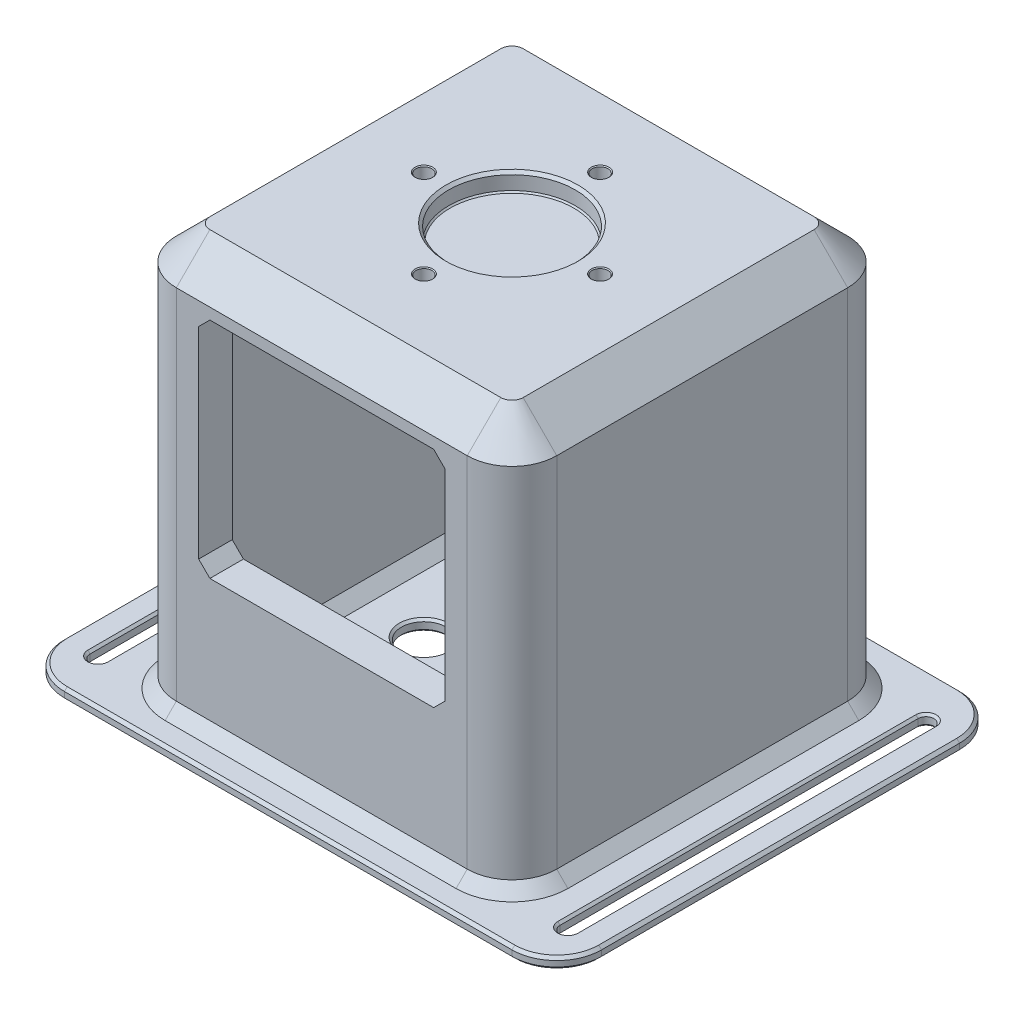
from build123d import *

# Parameters (mm, degrees)
SKETCH1_W                   = 152.4
SKETCH1_H                   = 127
BOSS_EXTRUDE1_DEPTH         = 3.175
SKETCH2_W                   = 69.85
SKETCH2_H                   = 9.525
BOSS_EXTRUDE2_DEPTH         = 38.1
BOSS_EXTRUDE3_DEPTH         = 101.6
BOSS_EXTRUDE4_START         = 101.6
SKETCH2_4_W                 = 69.85
SKETCH2_4_H                 = 9.525
SKETCH2_4_W_2               = 88.9
SKETCH2_4_H_2               = 88.9
BOSS_EXTRUDE4_DEPTH         = 12.7
CUT_EXTRUDE1_DEPTH          = 154.750010163
CUT_EXTRUDE1_DEPTH_BACK     = 5.08
SKETCH7_R                   = 17.9578
F_8_START                   = -50.8
F_8_CLEARANCE_SLOT1_2_DEPTH = 101.6
CIRPATTERN1_COUNT           = 4
FILLET2_R                   = 3.175
FILLET1_R                   = 12.7
CHAMFER1_SIZE               = 3.175
CHAMFER2_SIZE               = 9.525
CHAMFER4_SIZE               = 3.175
CHAMFER3_SIZE               = 0.79375
CHAMFER5_SIZE               = 0.79375
CHAMFER6_SIZE               = 0.396875


with BuildPart() as part:
    # Sketch1 → Boss-Extrude1 (new body)
    with BuildSketch(Plane(origin=(0, 0, 0), x_dir=(1, 0, 0), z_dir=(0, 1, 0))):
        Rectangle(SKETCH1_W, SKETCH1_H)
    extrude(amount=BOSS_EXTRUDE1_DEPTH)

    # Sketch2 → Boss-Extrude2 (add)
    with BuildSketch(Plane(origin=(0, 3.175, 0), x_dir=(1, 0, 0), z_dir=(0, 1, 0))):
        Polygon((-34.925, 53.975), (-53.975, 53.975), (-53.975, -53.975), (-34.925, -53.975), (-34.925, -44.45), (-44.45, -44.45), (-44.45, 44.45), (-34.925, 44.45), align=None)
        with Locations((0, 49.2125)):
            Rectangle(SKETCH2_W, SKETCH2_H)
        Polygon((53.975, 53.975), (34.925, 53.975), (34.925, 44.45), (44.45, 44.45), (44.45, -44.45), (34.925, -44.45), (34.925, -53.975), (53.975, -53.975), align=None)
        with Locations((0, -49.2125)):
            Rectangle(SKETCH2_W, SKETCH2_H)
    extrude(amount=BOSS_EXTRUDE2_DEPTH)

    # Sketch2<3> → Boss-Extrude3 (add)
    with BuildSketch(Plane(origin=(0, 3.175, 0), x_dir=(1, 0, 0), z_dir=(0, 1, 0))):
        Polygon((-34.925, 53.975), (-53.975, 53.975), (-53.975, -53.975), (-34.925, -53.975), (-34.925, -44.45), (-44.45, -44.45), (-44.45, 44.45), (-34.925, 44.45), align=None)
        Polygon((53.975, 53.975), (34.925, 53.975), (34.925, 44.45), (44.45, 44.45), (44.45, -44.45), (34.925, -44.45), (34.925, -53.975), (53.975, -53.975), align=None)
    extrude(amount=BOSS_EXTRUDE3_DEPTH)

    # Sketch2<4> → Boss-Extrude4 (add)
    with BuildSketch(Plane(origin=(0, 3.175, 0), x_dir=(1, 0, 0), z_dir=(0, 1, 0)).offset(BOSS_EXTRUDE4_START)):
        with Locations((0, 49.2125)):
            Rectangle(SKETCH2_4_W, SKETCH2_4_H)
        Polygon((-34.925, 53.975), (-53.975, 53.975), (-53.975, -53.975), (-34.925, -53.975), (-34.925, -44.45), (-44.45, -44.45), (-44.45, 44.45), (-34.925, 44.45), align=None)
        with Locations((0, -49.2125)):
            Rectangle(SKETCH2_4_W, SKETCH2_4_H)
        Polygon((53.975, 53.975), (34.925, 53.975), (34.925, 44.45), (44.45, 44.45), (44.45, -44.45), (34.925, -44.45), (34.925, -53.975), (53.975, -53.975), align=None)
        Rectangle(SKETCH2_4_W_2, SKETCH2_4_H_2)
    extrude(amount=BOSS_EXTRUDE4_DEPTH)

    # Sketch7 → Cut-Extrude1 (cut, two sides: drawn at the far end of the back side and taken through both)
    with BuildSketch(Plane(origin=(0, 117.475, 0), x_dir=(1, 0, 0), z_dir=(0, 1, 0)).offset(-CUT_EXTRUDE1_DEPTH_BACK)):
        with Locations(Location((0, 0, 0), (0, 0, 90))):
            Circle(SKETCH7_R)
    extrude(amount=CUT_EXTRUDE1_DEPTH + CUT_EXTRUDE1_DEPTH_BACK, mode=Mode.SUBTRACT)

    # #8 Clearance Slot1: read off the stored shape, not the designer's step
    # #8 Clearance Slot1 outline → #8 Clearance Slot1 (revolve, cut)
    with BuildSketch(Plane(origin=(66.675, 0, -50.8), x_dir=(1, 0, 0), z_dir=(0, 0, 1))):
        Polygon((0, 0), (2.8829, 0), (2.2479, 0.635), (2.2479, 2.54), (2.8829, 3.175), (0, 3.175), align=None)
    revolve(axis=Axis((66.675, 0, -50.8), (0, 1, 0)), mode=Mode.SUBTRACT)

    # 8 Clearance Slot1 2 outline → 8 Clearance Slot1 2 (cut)
    with BuildSketch(Plane.XY.offset(F_8_START)):
        Polygon((69.5579, 3.175), (63.7921, 3.175), (64.4271, 2.54), (64.4271, 0.635), (63.7921, 0), (69.5579, 0), (68.9229, 0.635), (68.9229, 2.54), align=None)
        Polygon((-64.4271, 2.54), (-63.7921, 3.175), (-69.5579, 3.175), (-68.9229, 2.54), (-68.9229, 0.635), (-69.5579, 0), (-63.7921, 0), (-64.4271, 0.635), align=None)
    extrude(amount=F_8_CLEARANCE_SLOT1_2_DEPTH, mode=Mode.SUBTRACT)

    # 8 Clearance Slot1 3 outline → 8 Clearance Slot1 3 (revolve, cut)
    with BuildSketch(Plane(origin=(66.675, 0, 50.8), x_dir=(1, 0, 0), z_dir=(0, 0, 1))):
        Polygon((0, 0), (2.8829, 0), (2.2479, 0.635), (2.2479, 2.54), (2.8829, 3.175), (0, 3.175), align=None)
    revolve(axis=Axis((66.675, 0, 50.8), (0, 1, 0)), mode=Mode.SUBTRACT)

    # 8 Clearance Slot1 4 outline → 8 Clearance Slot1 4 (revolve, cut)
    with BuildSketch(Plane(origin=(-66.675, 0, -50.8), x_dir=(1, 0, 0), z_dir=(0, 0, 1))):
        Polygon((0, 0), (2.8829, 0), (2.2479, 0.635), (2.2479, 2.54), (2.8829, 3.175), (0, 3.175), align=None)
    revolve(axis=Axis((-66.675, 0, -50.8), (0, 1, 0)), mode=Mode.SUBTRACT)

    # 8 Clearance Slot1 5 outline → 8 Clearance Slot1 5 (revolve, cut)
    with BuildSketch(Plane(origin=(-66.675, 0, 50.8), x_dir=(1, 0, 0), z_dir=(0, 0, 1))):
        Polygon((0, 0), (2.8829, 0), (2.2479, 0.635), (2.2479, 2.54), (2.8829, 3.175), (0, 3.175), align=None)
    revolve(axis=Axis((-66.675, 0, 50.8), (0, 1, 0)), mode=Mode.SUBTRACT)

    # Sketch11 → 1/2 (0.5) Diameter Hole1 (revolve, cut)
    with BuildSketch(Plane(origin=(25, 0, 0), x_dir=(0, 0, -1), z_dir=(1, 0, 0))):
        Polygon((0, 0), (0, 3.175), (6.985, 3.175), (6.35, 2.54), (6.35, 0.635), (6.985, 0), align=None)
    f_1_2_0_5_diameter_hole1 = revolve(axis=Axis((25, -6.35, 0), (0, 1, 0)), mode=Mode.SUBTRACT)

    # Sketch13 → #8 Clearance Hole2 (revolve, cut)
    with BuildSketch(Plane(origin=(25, 104.775, 0), x_dir=(0, 0, -1), z_dir=(1, 0, 0))):
        Polygon((0, 0), (0, 12.7), (2.5019, 12.7), (2.2479, 12.446), (2.2479, 0.635), (2.8829, 0), align=None)
    f_8_clearance_hole2 = revolve(axis=Axis((25, 98.425, 0), (0, 1, 0)), mode=Mode.SUBTRACT)

    # CirPattern1: 1/2 (0.5) Diameter Hole1, #8 Clearance Hole2 ×4 about axis
    cirpattern1_axis = Axis((0, 0, 0), (0, 1, 0))
    add([f_1_2_0_5_diameter_hole1.rotate(cirpattern1_axis, i * 360 / CIRPATTERN1_COUNT) for i in range(1, CIRPATTERN1_COUNT)], mode=Mode.SUBTRACT)
    add([f_8_clearance_hole2.rotate(cirpattern1_axis, i * 360 / CIRPATTERN1_COUNT) for i in range(1, CIRPATTERN1_COUNT)], mode=Mode.SUBTRACT)

    # Fillet2
    fillet2_edges = [part.edges().sort_by_distance(p)[0] for p in [
        (-44.45, 53.975, -44.45),
        (44.45, 53.975, -44.45),
        (44.45, 53.975, 44.45),
        (-44.45, 53.975, 44.45),
    ]]
    fillet(fillet2_edges, radius=FILLET2_R)

    # Fillet1
    fillet1_edges = [part.edges().sort_by_distance(p)[0] for p in [
        (53.975, 60.325, 53.975),
        (53.975, 60.325, -53.975),
        (-53.975, 60.325, -53.975),
        (-53.975, 60.325, 53.975),
        (76.2, 1.5875, 63.5),
        (-76.2, 1.5875, 63.5),
        (-76.2, 1.5875, -63.5),
        (76.2, 1.5875, -63.5),
    ]]
    fillet(fillet1_edges, radius=FILLET1_R)

    # Chamfer1
    chamfer1_edges = [part.edges().sort_by_distance(p)[0] for p in [
        (0, 3.175, -44.45),
        (-44.45, 3.175, 0),
        (0, 3.175, 44.45),
        (44.45, 3.175, 0),
        (43.52006403, 3.175, 43.52006403),
        (-43.52006403, 3.175, 43.52006403),
        (43.52006403, 3.175, -43.52006403),
        (-43.52006403, 3.175, -43.52006403),
        (53.975, 3.175, 0),
        (0, 3.175, 53.975),
        (-53.975, 3.175, 0),
        (0, 3.175, -53.975),
        (-50.255256121, 3.175, -50.255256121),
        (50.255256121, 3.175, -50.255256121),
        (50.255256121, 3.175, 50.255256121),
        (-50.255256121, 3.175, 50.255256121),
    ]]
    chamfer(chamfer1_edges, length=CHAMFER1_SIZE)

    # Chamfer2
    chamfer2_edges = [part.edges().sort_by_distance(p)[0] for p in [
        (-53.975, 117.475, 0),
        (0, 117.475, -53.975),
        (0, 117.475, 53.975),
        (53.975, 117.475, 0),
        (-50.255256121, 117.475, 50.255256121),
        (50.255256121, 117.475, 50.255256121),
        (50.255256121, 117.475, -50.255256121),
        (-50.255256121, 117.475, -50.255256121),
    ]]
    chamfer(chamfer2_edges, length=CHAMFER2_SIZE)

    # Chamfer4
    chamfer4_edges = [part.edges().sort_by_distance(p)[0] for p in [
        (-38.1, 104.775, -44.45),
        (-44.45, 104.775, 0),
        (44.45, 104.775, 0),
        (-38.1, 104.775, 44.45),
        (43.52006403, 104.775, 43.52006403),
        (-43.52006403, 104.775, 43.52006403),
        (43.52006403, 104.775, -43.52006403),
        (-43.52006403, 104.775, -43.52006403),
        (-34.925, 41.275, 49.2125),
        (-34.925, 41.275, -49.2125),
        (-34.925, 104.775, -49.2125),
        (-34.925, 104.775, 49.2125),
        (34.925, 41.275, -49.2125),
        (34.925, 104.775, -49.2125),
        (38.1, 104.775, 44.45),
        (34.925, 41.275, 49.2125),
        (34.925, 104.775, 49.2125),
        (38.1, 104.775, -44.45),
    ]]
    chamfer(chamfer4_edges, length=CHAMFER4_SIZE)

    # Chamfer3
    chamfer3_edges = [part.edges().sort_by_distance(p)[0] for p in [
        (0, 0, -63.5),
        (0, 3.175, -63.5),
        (76.2, 0, 0),
        (0, 0, 63.5),
        (-76.2, 0, 0),
        (72.480256121, 0, 59.780256121),
        (-72.480256121, 0, 59.780256121),
        (-72.480256121, 0, -59.780256121),
        (72.480256121, 0, -59.780256121),
        (76.2, 3.175, 0),
        (-76.2, 3.175, 0),
        (0, 3.175, 63.5),
        (72.480256121, 3.175, 59.780256121),
        (-72.480256121, 3.175, 59.780256121),
        (-72.480256121, 3.175, -59.780256121),
        (72.480256121, 3.175, -59.780256121),
    ]]
    chamfer(chamfer3_edges, length=CHAMFER3_SIZE)

    # Chamfer5
    chamfer5_edges = [part.edges().sort_by_distance(p)[0] for p in [
        (0, 117.475, 17.9578),
    ]]
    chamfer(chamfer5_edges, length=CHAMFER5_SIZE)

    # Chamfer6
    chamfer6_edges = [part.edges().sort_by_distance(p)[0] for p in [
        (0, 112.395, 17.9578),
    ]]
    chamfer(chamfer6_edges, length=CHAMFER6_SIZE)


solid = part.part
